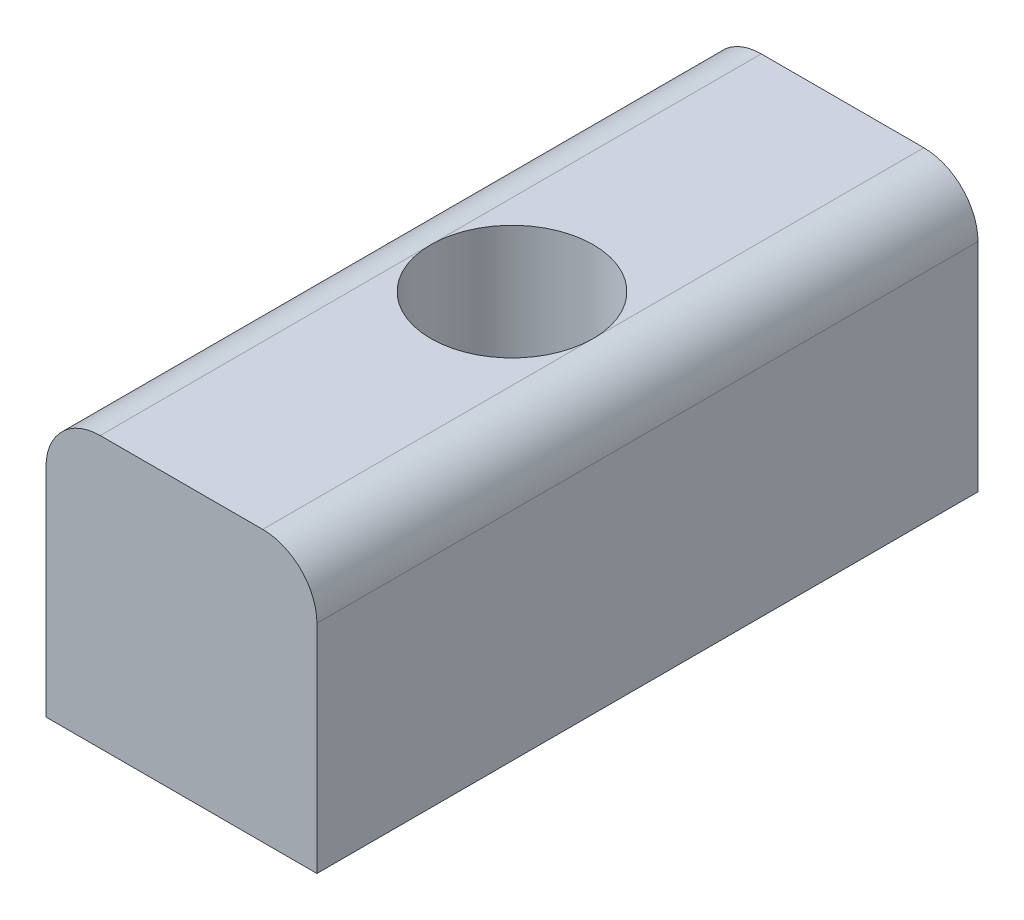
from build123d import *

# Parameters (mm, degrees)
SKETCH1_W           = 10
SKETCH1_H           = 24.4
SKETCH1_R           = 3
BOSS_EXTRUDE1_DEPTH = 10
FILLET1_R           = 2


with BuildPart() as part:
    # Sketch1 → Boss-Extrude1 (new body)
    with BuildSketch(Plane(origin=(0, 0, 0), x_dir=(1, 0, 0), z_dir=(0, 1, 0))):
        Rectangle(SKETCH1_W, SKETCH1_H)
        with Locations(Location((0, 0, 0), (0, 0, 270))):
            Circle(SKETCH1_R, mode=Mode.SUBTRACT)
    extrude(amount=BOSS_EXTRUDE1_DEPTH)

    # Fillet1
    fillet1_edges = [part.edges().sort_by_distance(p)[0] for p in [
        (-5, 10, 0),
        (5, 10, 0),
    ]]
    fillet(fillet1_edges, radius=FILLET1_R - 0.0001)  # a hair under: the kernel refuses the full size


solid = part.part
